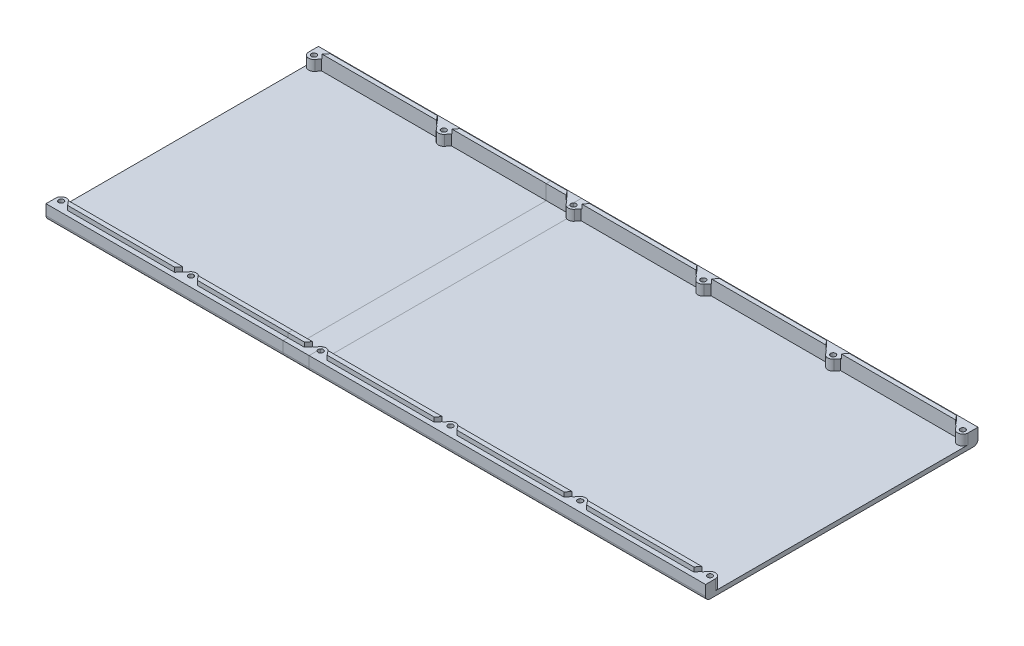
from build123d import *

# Parameters (mm, degrees)
BOSS_EXTRUDE1_DEPTH                     = 445
FILLET1_R                               = 3
BOSS_EXTRUDE2_START                     = -10
BOSS_EXTRUDE2_DEPTH                     = 7.000001
CUT_EXTRUDE2_DEPTH                      = 10
CBORE_FOR_M6_HEX_HEAD_BOLT1_D           = 3.5
CBORE_FOR_M6_HEX_HEAD_BOLT1_CBORE_D     = 6.5
CBORE_FOR_M6_HEX_HEAD_BOLT1_CBORE_DEPTH = 4
SPLIT1_START                            = -329.974562358
SPLIT1_DEPTH                            = 177.5
SPLIT1_START_2                          = -20.219509128
SPLIT1_2_OUTLINE_W                      = 160
SPLIT1_2_OUTLINE_H                      = 183.812885504
SPLIT1_2_OUTLINE_R                      = 3.25
SPLIT1_2_DEPTH                          = 3
SPLIT1_START_3                          = -17.219509128
SPLIT1_3_OUTLINE_R                      = 3.25
SPLIT1_3_DEPTH                          = 7
SPLIT1_START_4                          = -10.219509128
SPLIT1_4_DEPTH                          = 3
SPLIT1_START_5                          = -16.219509128
SPLIT1_5_OUTLINE_R                      = 3.25
SPLIT1_5_OUTLINE_R_2                    = 1.75
SPLIT1_5_DEPTH                          = 6
SPLIT1_START_6                          = -331
SPLIT1_6_DEPTH                          = 162
SPLIT1_7_DEPTH                          = 3
SPLIT1_8_DEPTH                          = 7
SPLIT1_9_DEPTH                          = 3
SPLIT1_10_DEPTH                         = 6
SPLIT1_START_7                          = -169.974562358
SPLIT1_11_DEPTH                         = 15.470068639
SPLIT1_START_8                          = -154.504562358
SPLIT1_12_DEPTH                         = 2.03
SPLIT1_13_DEPTH                         = 3


with BuildPart() as part:
    # Sketch1 → Boss-Extrude1 (new body)
    with BuildSketch(Plane.ZY.offset(329.974562358)):
        Polygon((-32.648970599, -10.219509128), (-32.648970599, -20.219509128), (151.163914905, -20.219509128), (151.163914905, -10.219509128), (148.163914905, -10.219509128), (147.863914905, -10.219509128), (147.863914905, -7.219509128), (144.863914905, -7.219509128), (144.863914905, -17.219509128), (-26.348970599, -17.219509128), (-26.348970599, -7.219509128), (-29.348970599, -7.219509128), (-29.348970599, -10.219509128), (-29.648970599, -10.219509128), align=None)
    extrude(amount=-BOSS_EXTRUDE1_DEPTH)

    # Fillet1
    fillet1_edges = [part.edges().sort_by_distance(p)[0] for p in [
        (-107.474562358, -20.219509128, 151.163914905),
        (-107.474562358, -20.219509128, -32.648970599),
    ]]
    fillet(fillet1_edges, radius=FILLET1_R)

    # Sketch2 → Boss-Extrude2 (add)
    with BuildSketch(Plane(origin=(0, -0.219509128, 0), x_dir=(1, 0, 0), z_dir=(0, 1, 0)).offset(BOSS_EXTRUDE2_START)):
        with BuildLine():
            Line((-329.974562358, 29.648970599), (-329.974562358, 26.048970599))
            ThreePointArc((-329.974562358, 26.048970599), (-327.567305693, 22.652301151), (-323.564916059, 23.798217909))
            Line((-323.564916059, 23.798217909), (-318.882172227, 29.648970599))
            Line((-318.882172227, 29.648970599), (-246.30695249, 29.648970599))
            Line((-246.30695249, 29.648970599), (-241.624208658, 23.798217909))
            ThreePointArc((-241.624208658, 23.798217909), (-238.814562358, 22.448970599), (-236.004916059, 23.798217909))
            Line((-236.004916059, 23.798217909), (-231.322172227, 29.648970599))
            Line((-231.322172227, 29.648970599), (-158.74695249, 29.648970599))
            Line((-158.74695249, 29.648970599), (-154.064208658, 23.798217909))
            ThreePointArc((-154.064208658, 23.798217909), (-151.254562358, 22.448970599), (-148.444916059, 23.798217909))
            Line((-148.444916059, 23.798217909), (-143.762172227, 29.648970599))
            Line((-143.762172227, 29.648970599), (-71.18695249, 29.648970599))
            Line((-71.18695249, 29.648970599), (-66.504208658, 23.798217909))
            ThreePointArc((-66.504208658, 23.798217909), (-63.694562358, 22.448970599), (-60.884916059, 23.798217909))
            Line((-60.884916059, 23.798217909), (-56.202172227, 29.648970599))
            Line((-56.202172227, 29.648970599), (16.37304751, 29.648970599))
            Line((16.37304751, 29.648970599), (21.055791342, 23.798217909))
            ThreePointArc((21.055791342, 23.798217909), (23.865437642, 22.448970599), (26.675083941, 23.798217909))
            Line((26.675083941, 23.798217909), (31.357827773, 29.648970599))
            Line((31.357827773, 29.648970599), (103.93304751, 29.648970599))
            Line((103.93304751, 29.648970599), (108.615791342, 23.798217909))
            ThreePointArc((108.615791342, 23.798217909), (112.618180976, 22.652301151), (115.025437642, 26.048970599))
            Line((115.025437642, 26.048970599), (115.025437642, 32.648970599))
            Line((115.025437642, 32.648970599), (-329.974562358, 32.648970599))
            Line((-329.974562358, 32.648970599), (-329.974562358, 29.648970599))
        make_face()
        with BuildLine():
            Line((115.025437642, -151.163914905), (115.025437642, -144.563914905))
            ThreePointArc((115.025437642, -144.563914905), (112.618180976, -141.167245457), (108.615791342, -142.313162215))
            Line((108.615791342, -142.313162215), (103.93304751, -148.163914905))
            Line((103.93304751, -148.163914905), (31.357827773, -148.163914905))
            Line((31.357827773, -148.163914905), (26.675083941, -142.313162215))
            ThreePointArc((26.675083941, -142.313162215), (23.865437642, -140.963914905), (21.055791342, -142.313162215))
            Line((21.055791342, -142.313162215), (16.37304751, -148.163914905))
            Line((16.37304751, -148.163914905), (-56.202172227, -148.163914905))
            Line((-56.202172227, -148.163914905), (-60.884916059, -142.313162215))
            ThreePointArc((-60.884916059, -142.313162215), (-63.694562358, -140.963914905), (-66.504208658, -142.313162215))
            Line((-66.504208658, -142.313162215), (-71.18695249, -148.163914905))
            Line((-71.18695249, -148.163914905), (-143.762172227, -148.163914905))
            Line((-143.762172227, -148.163914905), (-148.444916059, -142.313162215))
            ThreePointArc((-148.444916059, -142.313162215), (-151.254562358, -140.963914905), (-154.064208658, -142.313162215))
            Line((-154.064208658, -142.313162215), (-158.74695249, -148.163914905))
            Line((-158.74695249, -148.163914905), (-231.322172227, -148.163914905))
            Line((-231.322172227, -148.163914905), (-236.004916059, -142.313162215))
            ThreePointArc((-236.004916059, -142.313162215), (-238.814562358, -140.963914905), (-241.624208658, -142.313162215))
            Line((-241.624208658, -142.313162215), (-246.30695249, -148.163914905))
            Line((-246.30695249, -148.163914905), (-318.882172227, -148.163914905))
            Line((-318.882172227, -148.163914905), (-323.564916059, -142.313162215))
            ThreePointArc((-323.564916059, -142.313162215), (-327.567305693, -141.167245457), (-329.974562358, -144.563914905))
            Line((-329.974562358, -144.563914905), (-329.974562358, -151.163914905))
            Line((-329.974562358, -151.163914905), (115.025437642, -151.163914905))
        make_face()
    extrude(amount=-BOSS_EXTRUDE2_DEPTH)

    # Sketch2<3> → Cut-Extrude2 (cut)
    # profile 1 of 4: a face of its own
    with BuildSketch(Plane(origin=(0, -0.219509128, 0), x_dir=(1, 0, 0), z_dir=(0, 1, 0))):
        with BuildLine():
            Line((16.228901261, 29.348970599), (20.821613339, 23.610706153))
            ThreePointArc((20.821613339, 23.610706153), (23.865437642, 22.148970613), (26.909261944, 23.610706153))
            Line((26.909261944, 23.610706153), (31.501974023, 29.348970599))
            Line((31.501974023, 29.348970599), (103.788901261, 29.348970599))
            Line((103.788901261, 29.348970599), (108.381613339, 23.610706153))
            ThreePointArc((108.381613339, 23.610706153), (112.717545446, 22.36923456), (115.325437642, 26.048970599))
            Line((115.325437642, 26.048970599), (115.325437642, 32.948970599))
            Line((115.325437642, 32.948970599), (-330.274562358, 32.948970599))
            Line((-330.274562358, 32.948970599), (-330.274562358, 29.648970599))
            Line((-330.274562358, 29.648970599), (-330.274562358, 26.048970599))
            ThreePointArc((-330.274562358, 26.048970599), (-327.666670167, 22.369234548), (-323.330738056, 23.610706153))
            Line((-323.330738056, 23.610706153), (-318.738025977, 29.348970599))
            Line((-318.738025977, 29.348970599), (-246.451098739, 29.348970599))
            Line((-246.451098739, 29.348970599), (-241.858386661, 23.610706153))
            ThreePointArc((-241.858386661, 23.610706153), (-238.814562358, 22.148970613), (-235.770738056, 23.610706153))
            Line((-235.770738056, 23.610706153), (-231.178025977, 29.348970599))
            Line((-231.178025977, 29.348970599), (-158.891098739, 29.348970599))
            Line((-158.891098739, 29.348970599), (-154.298386661, 23.610706153))
            ThreePointArc((-154.298386661, 23.610706153), (-151.254562358, 22.148970613), (-148.210738056, 23.610706153))
            Line((-148.210738056, 23.610706153), (-143.618025977, 29.348970599))
            Line((-143.618025977, 29.348970599), (-71.331098739, 29.348970599))
            Line((-71.331098739, 29.348970599), (-66.738386661, 23.610706153))
            ThreePointArc((-66.738386661, 23.610706153), (-63.694562358, 22.148970613), (-60.650738056, 23.610706153))
            Line((-60.650738056, 23.610706153), (-56.058025977, 29.348970599))
            Line((-56.058025977, 29.348970599), (16.228901261, 29.348970599))
        make_face()
        with BuildLine():
            ThreePointArc((-329.974562358, 26.048970599), (-327.567305693, 22.652301151), (-323.564916059, 23.798217909))
            Line((-323.564916059, 23.798217909), (-318.882172227, 29.648970599))
            Line((-318.882172227, 29.648970599), (-246.30695249, 29.648970599))
            Line((-246.30695249, 29.648970599), (-241.624208658, 23.798217909))
            ThreePointArc((-241.624208658, 23.798217909), (-238.814562358, 22.448970599), (-236.004916059, 23.798217909))
            Line((-236.004916059, 23.798217909), (-231.322172227, 29.648970599))
            Line((-231.322172227, 29.648970599), (-158.74695249, 29.648970599))
            Line((-158.74695249, 29.648970599), (-154.064208658, 23.798217909))
            ThreePointArc((-154.064208658, 23.798217909), (-151.254562358, 22.448970599), (-148.444916059, 23.798217909))
            Line((-148.444916059, 23.798217909), (-143.762172227, 29.648970599))
            Line((-143.762172227, 29.648970599), (-71.18695249, 29.648970599))
            Line((-71.18695249, 29.648970599), (-66.504208658, 23.798217909))
            ThreePointArc((-66.504208658, 23.798217909), (-63.694562358, 22.448970599), (-60.884916059, 23.798217909))
            Line((-60.884916059, 23.798217909), (-56.202172227, 29.648970599))
            Line((-56.202172227, 29.648970599), (16.37304751, 29.648970599))
            Line((16.37304751, 29.648970599), (21.055791342, 23.798217909))
            ThreePointArc((21.055791342, 23.798217909), (23.865437642, 22.448970599), (26.675083941, 23.798217909))
            Line((26.675083941, 23.798217909), (31.357827773, 29.648970599))
            Line((31.357827773, 29.648970599), (103.93304751, 29.648970599))
            Line((103.93304751, 29.648970599), (108.615791342, 23.798217909))
            ThreePointArc((108.615791342, 23.798217909), (112.618180976, 22.652301151), (115.025437642, 26.048970599))
            Line((115.025437642, 26.048970599), (115.025437642, 32.648970599))
            Line((115.025437642, 32.648970599), (-329.974562358, 32.648970599))
            Line((-329.974562358, 32.648970599), (-329.974562358, 29.648970599))
            Line((-329.974562358, 29.648970599), (-329.974562358, 26.048970599))
        make_face(mode=Mode.SUBTRACT)
    # profile 2 of 4: a face of its own
    with BuildSketch(Plane(origin=(0, -0.219509128, 0), x_dir=(1, 0, 0), z_dir=(0, 1, 0))):
        with BuildLine():
            Line((-329.974562358, 29.648970599), (-329.974562358, 26.048970599))
            ThreePointArc((-329.974562358, 26.048970599), (-327.567305693, 22.652301151), (-323.564916059, 23.798217909))
            Line((-323.564916059, 23.798217909), (-318.882172227, 29.648970599))
            Line((-318.882172227, 29.648970599), (-246.30695249, 29.648970599))
            Line((-246.30695249, 29.648970599), (-241.624208658, 23.798217909))
            ThreePointArc((-241.624208658, 23.798217909), (-238.814562358, 22.448970599), (-236.004916059, 23.798217909))
            Line((-236.004916059, 23.798217909), (-231.322172227, 29.648970599))
            Line((-231.322172227, 29.648970599), (-158.74695249, 29.648970599))
            Line((-158.74695249, 29.648970599), (-154.064208658, 23.798217909))
            ThreePointArc((-154.064208658, 23.798217909), (-151.254562358, 22.448970599), (-148.444916059, 23.798217909))
            Line((-148.444916059, 23.798217909), (-143.762172227, 29.648970599))
            Line((-143.762172227, 29.648970599), (-71.18695249, 29.648970599))
            Line((-71.18695249, 29.648970599), (-66.504208658, 23.798217909))
            ThreePointArc((-66.504208658, 23.798217909), (-63.694562358, 22.448970599), (-60.884916059, 23.798217909))
            Line((-60.884916059, 23.798217909), (-56.202172227, 29.648970599))
            Line((-56.202172227, 29.648970599), (16.37304751, 29.648970599))
            Line((16.37304751, 29.648970599), (21.055791342, 23.798217909))
            ThreePointArc((21.055791342, 23.798217909), (23.865437642, 22.448970599), (26.675083941, 23.798217909))
            Line((26.675083941, 23.798217909), (31.357827773, 29.648970599))
            Line((31.357827773, 29.648970599), (103.93304751, 29.648970599))
            Line((103.93304751, 29.648970599), (108.615791342, 23.798217909))
            ThreePointArc((108.615791342, 23.798217909), (112.618180976, 22.652301151), (115.025437642, 26.048970599))
            Line((115.025437642, 26.048970599), (115.025437642, 32.648970599))
            Line((115.025437642, 32.648970599), (-329.974562358, 32.648970599))
            Line((-329.974562358, 32.648970599), (-329.974562358, 29.648970599))
        make_face()
    # profile 3 of 4: a face of its own
    with BuildSketch(Plane(origin=(0, -0.219509128, 0), x_dir=(1, 0, 0), z_dir=(0, 1, 0))):
        with BuildLine():
            Line((-318.738025977, -147.863914905), (-323.330738056, -142.125650459))
            ThreePointArc((-323.330738056, -142.125650459), (-327.666670163, -140.884178866), (-330.274562358, -144.563914905))
            Line((-330.274562358, -144.563914905), (-330.274562358, -151.463914905))
            Line((-330.274562358, -151.463914905), (115.325437642, -151.463914905))
            Line((115.325437642, -151.463914905), (115.325437642, -144.563914905))
            ThreePointArc((115.325437642, -144.563914905), (112.717545451, -140.884178853), (108.381613339, -142.125650459))
            Line((108.381613339, -142.125650459), (103.788901261, -147.863914905))
            Line((103.788901261, -147.863914905), (31.501974023, -147.863914905))
            Line((31.501974023, -147.863914905), (26.909261944, -142.125650459))
            ThreePointArc((26.909261944, -142.125650459), (23.865437642, -140.663914919), (20.821613339, -142.125650459))
            Line((20.821613339, -142.125650459), (16.228901261, -147.863914905))
            Line((16.228901261, -147.863914905), (-56.058025977, -147.863914905))
            Line((-56.058025977, -147.863914905), (-60.650738056, -142.125650459))
            ThreePointArc((-60.650738056, -142.125650459), (-63.694562358, -140.663914919), (-66.738386661, -142.125650459))
            Line((-66.738386661, -142.125650459), (-71.331098739, -147.863914905))
            Line((-71.331098739, -147.863914905), (-143.618025977, -147.863914905))
            Line((-143.618025977, -147.863914905), (-148.210738056, -142.125650459))
            ThreePointArc((-148.210738056, -142.125650459), (-151.254562358, -140.663914919), (-154.298386661, -142.125650459))
            Line((-154.298386661, -142.125650459), (-158.891098739, -147.863914905))
            Line((-158.891098739, -147.863914905), (-231.178025977, -147.863914905))
            Line((-231.178025977, -147.863914905), (-235.770738056, -142.125650459))
            ThreePointArc((-235.770738056, -142.125650459), (-238.814562358, -140.663914919), (-241.858386661, -142.125650459))
            Line((-241.858386661, -142.125650459), (-246.451098739, -147.863914905))
            Line((-246.451098739, -147.863914905), (-318.738025977, -147.863914905))
        make_face()
        with BuildLine():
            ThreePointArc((115.025437642, -144.563914905), (112.618180976, -141.167245457), (108.615791342, -142.313162215))
            Line((108.615791342, -142.313162215), (103.93304751, -148.163914905))
            Line((103.93304751, -148.163914905), (31.357827773, -148.163914905))
            Line((31.357827773, -148.163914905), (26.675083941, -142.313162215))
            ThreePointArc((26.675083941, -142.313162215), (23.865437642, -140.963914905), (21.055791342, -142.313162215))
            Line((21.055791342, -142.313162215), (16.37304751, -148.163914905))
            Line((16.37304751, -148.163914905), (-56.202172227, -148.163914905))
            Line((-56.202172227, -148.163914905), (-60.884916059, -142.313162215))
            ThreePointArc((-60.884916059, -142.313162215), (-63.694562358, -140.963914905), (-66.504208658, -142.313162215))
            Line((-66.504208658, -142.313162215), (-71.18695249, -148.163914905))
            Line((-71.18695249, -148.163914905), (-143.762172227, -148.163914905))
            Line((-143.762172227, -148.163914905), (-148.444916059, -142.313162215))
            ThreePointArc((-148.444916059, -142.313162215), (-151.254562358, -140.963914905), (-154.064208658, -142.313162215))
            Line((-154.064208658, -142.313162215), (-158.74695249, -148.163914905))
            Line((-158.74695249, -148.163914905), (-231.322172227, -148.163914905))
            Line((-231.322172227, -148.163914905), (-236.004916059, -142.313162215))
            ThreePointArc((-236.004916059, -142.313162215), (-238.814562358, -140.963914905), (-241.624208658, -142.313162215))
            Line((-241.624208658, -142.313162215), (-246.30695249, -148.163914905))
            Line((-246.30695249, -148.163914905), (-318.882172227, -148.163914905))
            Line((-318.882172227, -148.163914905), (-323.564916059, -142.313162215))
            ThreePointArc((-323.564916059, -142.313162215), (-327.567305693, -141.167245457), (-329.974562358, -144.563914905))
            Line((-329.974562358, -144.563914905), (-329.974562358, -151.163914905))
            Line((-329.974562358, -151.163914905), (115.025437642, -151.163914905))
            Line((115.025437642, -151.163914905), (115.025437642, -144.563914905))
        make_face(mode=Mode.SUBTRACT)
    # profile 4 of 4: a face of its own
    with BuildSketch(Plane(origin=(0, -0.219509128, 0), x_dir=(1, 0, 0), z_dir=(0, 1, 0))):
        with BuildLine():
            Line((115.025437642, -151.163914905), (115.025437642, -144.563914905))
            ThreePointArc((115.025437642, -144.563914905), (112.618180976, -141.167245457), (108.615791342, -142.313162215))
            Line((108.615791342, -142.313162215), (103.93304751, -148.163914905))
            Line((103.93304751, -148.163914905), (31.357827773, -148.163914905))
            Line((31.357827773, -148.163914905), (26.675083941, -142.313162215))
            ThreePointArc((26.675083941, -142.313162215), (23.865437642, -140.963914905), (21.055791342, -142.313162215))
            Line((21.055791342, -142.313162215), (16.37304751, -148.163914905))
            Line((16.37304751, -148.163914905), (-56.202172227, -148.163914905))
            Line((-56.202172227, -148.163914905), (-60.884916059, -142.313162215))
            ThreePointArc((-60.884916059, -142.313162215), (-63.694562358, -140.963914905), (-66.504208658, -142.313162215))
            Line((-66.504208658, -142.313162215), (-71.18695249, -148.163914905))
            Line((-71.18695249, -148.163914905), (-143.762172227, -148.163914905))
            Line((-143.762172227, -148.163914905), (-148.444916059, -142.313162215))
            ThreePointArc((-148.444916059, -142.313162215), (-151.254562358, -140.963914905), (-154.064208658, -142.313162215))
            Line((-154.064208658, -142.313162215), (-158.74695249, -148.163914905))
            Line((-158.74695249, -148.163914905), (-231.322172227, -148.163914905))
            Line((-231.322172227, -148.163914905), (-236.004916059, -142.313162215))
            ThreePointArc((-236.004916059, -142.313162215), (-238.814562358, -140.963914905), (-241.624208658, -142.313162215))
            Line((-241.624208658, -142.313162215), (-246.30695249, -148.163914905))
            Line((-246.30695249, -148.163914905), (-318.882172227, -148.163914905))
            Line((-318.882172227, -148.163914905), (-323.564916059, -142.313162215))
            ThreePointArc((-323.564916059, -142.313162215), (-327.567305693, -141.167245457), (-329.974562358, -144.563914905))
            Line((-329.974562358, -144.563914905), (-329.974562358, -151.163914905))
            Line((-329.974562358, -151.163914905), (115.025437642, -151.163914905))
        make_face()
    extrude(amount=-CUT_EXTRUDE2_DEPTH, mode=Mode.SUBTRACT)

    # CBORE for M6 Hex Head Bolt1 (through all)
    with Locations(Plane(origin=(0, -20.219509128, 0), x_dir=(-1, 0, 0), z_dir=(0, -1, 0))):
        with Locations((326.374562358, -144.563914905), (238.814562358, -144.563914905), (151.254562358, -144.563914905), (63.694562358, -144.563914905), (-23.865437642, -144.563914905), (-111.425437642, -144.563914905), (-111.425437642, 26.048970599), (-23.865437642, 26.048970599), (63.694562358, 26.048970599), (151.254562358, 26.048970599), (238.814562358, 26.048970599), (326.374562358, 26.048970599)):
            CounterBoreHole(CBORE_FOR_M6_HEX_HEAD_BOLT1_D / 2, CBORE_FOR_M6_HEX_HEAD_BOLT1_CBORE_D / 2, CBORE_FOR_M6_HEX_HEAD_BOLT1_CBORE_DEPTH)

    # Split1: read off the stored shape, not the designer's step
    # Split1 outline → Split1 (cut)
    with BuildSketch(Plane.YZ.offset(SPLIT1_START)):
        with BuildLine():
            Line((-7.219509128, -26.348970599), (-10.219509128, -26.348970599))
            Line((-10.219509128, -26.348970599), (-10.219509128, 144.863914905))
            Line((-10.219509128, 144.863914905), (-7.219509128, 144.863914905))
            Line((-7.219509128, 144.863914905), (-7.219509128, 147.863914905))
            Line((-7.219509128, 147.863914905), (-10.219509128, 147.863914905))
            Line((-10.219509128, 147.863914905), (-10.219509128, 151.163914905))
            Line((-10.219509128, 151.163914905), (-17.219509128, 151.163914905))
            ThreePointArc((-17.219509128, 151.163914905), (-19.340829471, 150.285235248), (-20.219509128, 148.163914905))
            Line((-20.219509128, 148.163914905), (-20.219509128, -29.648970599))
            ThreePointArc((-20.219509128, -29.648970599), (-19.340829472, -31.770290943), (-17.219509128, -32.648970599))
            Line((-17.219509128, -32.648970599), (-10.219509128, -32.648970599))
            Line((-10.219509128, -32.648970599), (-10.219509128, -29.348970599))
            Line((-10.219509128, -29.348970599), (-7.219509128, -29.348970599))
            Line((-7.219509128, -29.348970599), (-7.219509128, -26.348970599))
        make_face()
    extrude(amount=SPLIT1_DEPTH, mode=Mode.SUBTRACT)


with BuildPart() as body_2:
    # Split1 2 outline → Split1 2 (new body)
    with BuildSketch(Plane(origin=(0, 0, 0), x_dir=(1, 0, 0), z_dir=(0, 1, 0)).offset(SPLIT1_START_2)):
        with Locations((-249.974562358, -59.257472153)):
            Rectangle(SPLIT1_2_OUTLINE_W, SPLIT1_2_OUTLINE_H)
        with Locations((-326.374562358, 26.048970599)):
            Circle(SPLIT1_2_OUTLINE_R, mode=Mode.SUBTRACT)
        with Locations((-238.814562358, 26.048970599)):
            Circle(SPLIT1_2_OUTLINE_R, mode=Mode.SUBTRACT)
        with Locations((-238.814562358, -144.563914905)):
            Circle(SPLIT1_2_OUTLINE_R, mode=Mode.SUBTRACT)
        with Locations((-326.374562358, -144.563914905)):
            Circle(SPLIT1_2_OUTLINE_R, mode=Mode.SUBTRACT)
    extrude(amount=SPLIT1_2_DEPTH)

    # Split1 3 outline → Split1 3 (add)
    # profile 1 of 2: a face of its own
    with BuildSketch(Plane(origin=(0, 0, 0), x_dir=(1, 0, 0), z_dir=(0, 1, 0)).offset(SPLIT1_START_3)):
        with BuildLine():
            Line((-169.974562358, 32.648970599), (-329.974562358, 32.648970599))
            Line((-329.974562358, 32.648970599), (-329.974562358, 26.048970599))
            ThreePointArc((-329.974562358, 26.048970599), (-327.567305692, 22.652301151), (-323.564916059, 23.798217909))
            Line((-323.564916059, 23.798217909), (-321.523380199, 26.348970599))
            Line((-321.523380199, 26.348970599), (-243.665744518, 26.348970599))
            Line((-243.665744518, 26.348970599), (-241.624208658, 23.798217909))
            ThreePointArc((-241.624208658, 23.798217909), (-238.814562359, 22.448970599), (-236.004916059, 23.798217909))
            Line((-236.004916059, 23.798217909), (-233.963380199, 26.348970599))
            Line((-233.963380199, 26.348970599), (-169.974562358, 26.348970599))
            Line((-169.974562358, 26.348970599), (-169.974562358, 32.648970599))
        make_face()
        with Locations((-326.374562358, 26.048970599)):
            Circle(SPLIT1_3_OUTLINE_R, mode=Mode.SUBTRACT)
        with Locations((-238.814562358, 26.048970599)):
            Circle(SPLIT1_3_OUTLINE_R, mode=Mode.SUBTRACT)
    # profile 2 of 2: a face of its own
    with BuildSketch(Plane(origin=(0, 0, 0), x_dir=(1, 0, 0), z_dir=(0, 1, 0)).offset(SPLIT1_START_3)):
        with BuildLine():
            Line((-169.974562358, -144.863914905), (-233.963380199, -144.863914905))
            Line((-233.963380199, -144.863914905), (-236.004916059, -142.313162215))
            ThreePointArc((-236.004916059, -142.313162215), (-238.814562359, -140.963914905), (-241.624208658, -142.313162215))
            Line((-241.624208658, -142.313162215), (-243.665744518, -144.863914905))
            Line((-243.665744518, -144.863914905), (-321.523380199, -144.863914905))
            Line((-321.523380199, -144.863914905), (-323.564916059, -142.313162215))
            ThreePointArc((-323.564916059, -142.313162215), (-327.567305692, -141.167245457), (-329.974562358, -144.563914905))
            Line((-329.974562358, -144.563914905), (-329.974562358, -151.163914905))
            Line((-329.974562358, -151.163914905), (-169.974562358, -151.163914905))
            Line((-169.974562358, -151.163914905), (-169.974562358, -144.863914905))
        make_face()
        with Locations((-326.374562358, -144.563914905)):
            Circle(SPLIT1_3_OUTLINE_R, mode=Mode.SUBTRACT)
        with Locations((-238.814562358, -144.563914905)):
            Circle(SPLIT1_3_OUTLINE_R, mode=Mode.SUBTRACT)
    extrude(amount=SPLIT1_3_DEPTH)

    # Split1 4 outline → Split1 4 (add)
    with BuildSketch(Plane(origin=(0, 0, 0), x_dir=(1, 0, 0), z_dir=(0, 1, 0)).offset(SPLIT1_START_4)):
        Polygon((-169.974562358, 26.348970599), (-169.974562358, 29.348970599), (-231.178025977, 29.348970599), (-233.579124143, 26.348970599), align=None)
        Polygon((-169.974562358, -147.863914905), (-169.974562358, -144.863914905), (-233.579124143, -144.863914905), (-231.178025977, -147.863914905), align=None)
        Polygon((-318.738025977, 29.348970599), (-321.139124143, 26.348970599), (-244.050000574, 26.348970599), (-246.451098739, 29.348970599), align=None)
        Polygon((-244.050000574, -144.863914905), (-321.139124143, -144.863914905), (-318.738025977, -147.863914905), (-246.451098739, -147.863914905), align=None)
    extrude(amount=SPLIT1_4_DEPTH)

    # Split1 5 outline → Split1 5 (add)
    # profile 1 of 4: a face of its own
    with BuildSketch(Plane(origin=(0, 0, 0), x_dir=(1, 0, 0), z_dir=(0, 1, 0)).offset(SPLIT1_START_5)):
        with Locations((-326.374562358, 26.048970599)):
            Circle(SPLIT1_5_OUTLINE_R)
        with Locations((-326.374562358, 26.048970599)):
            Circle(SPLIT1_5_OUTLINE_R_2, mode=Mode.SUBTRACT)
    # profile 2 of 4: a face of its own
    with BuildSketch(Plane(origin=(0, 0, 0), x_dir=(1, 0, 0), z_dir=(0, 1, 0)).offset(SPLIT1_START_5)):
        with Locations((-238.814562358, 26.048970599)):
            Circle(SPLIT1_5_OUTLINE_R)
        with Locations((-238.814562358, 26.048970599)):
            Circle(SPLIT1_5_OUTLINE_R_2, mode=Mode.SUBTRACT)
    # profile 3 of 4: a face of its own
    with BuildSketch(Plane(origin=(0, 0, 0), x_dir=(1, 0, 0), z_dir=(0, 1, 0)).offset(SPLIT1_START_5)):
        with Locations((-238.814562358, -144.563914905)):
            Circle(SPLIT1_5_OUTLINE_R)
        with Locations((-238.814562358, -144.563914905)):
            Circle(SPLIT1_5_OUTLINE_R_2, mode=Mode.SUBTRACT)
    # profile 4 of 4: a face of its own
    with BuildSketch(Plane(origin=(0, 0, 0), x_dir=(1, 0, 0), z_dir=(0, 1, 0)).offset(SPLIT1_START_5)):
        with Locations((-326.374562358, -144.563914905)):
            Circle(SPLIT1_5_OUTLINE_R)
        with Locations((-326.374562358, -144.563914905)):
            Circle(SPLIT1_5_OUTLINE_R_2, mode=Mode.SUBTRACT)
    extrude(amount=SPLIT1_5_DEPTH)

    # Split1 6 outline → Split1 6 (cut)
    with BuildSketch(Plane.YZ.offset(SPLIT1_START_6)):
        with BuildLine():
            Line((-20.219509128, -32.648970599), (-17.219509128, -32.648970599))
            ThreePointArc((-17.219509128, -32.648970599), (-19.340829472, -31.770290943), (-20.219509128, -29.648970599))
            Line((-20.219509128, -29.648970599), (-20.219509128, -32.648970599))
        make_face()
        with BuildLine():
            Line((-20.219509128, 151.163914905), (-20.219509128, 148.163914905))
            ThreePointArc((-20.219509128, 148.163914905), (-19.340829471, 150.285235248), (-17.219509128, 151.163914905))
            Line((-17.219509128, 151.163914905), (-20.219509128, 151.163914905))
        make_face()
    extrude(amount=SPLIT1_6_DEPTH, mode=Mode.SUBTRACT)


with BuildPart() as body_3:
    # Split1 7 outline → Split1 7 (new body)
    with BuildSketch(Plane(origin=(0, 0, 0), x_dir=(1, 0, 0), z_dir=(0, 1, 0)).offset(SPLIT1_START_2)):
        with BuildLine():
            Line((-158.891098739, 29.348970599), (-169.974562358, 29.348970599))
            Line((-169.974562358, 29.348970599), (-169.974562358, -147.863914905))
            Line((-169.974562358, -147.863914905), (-158.891098739, -147.863914905))
            Line((-158.891098739, -147.863914905), (-156.490000574, -144.863914905))
            Line((-156.490000574, -144.863914905), (-156.105744518, -144.863914905))
            Line((-156.105744518, -144.863914905), (-154.064208658, -142.313162215))
            ThreePointArc((-154.064208658, -142.313162215), (-153.347947807, -141.635137453), (-152.474562358, -141.176939853))
            Line((-152.474562358, -141.176939853), (-152.474562358, 22.661995548))
            ThreePointArc((-152.474562358, 22.661995548), (-153.347947807, 23.120193147), (-154.064208658, 23.798217909))
            Line((-154.064208658, 23.798217909), (-156.105744518, 26.348970599))
            Line((-156.105744518, 26.348970599), (-156.490000574, 26.348970599))
            Line((-156.490000574, 26.348970599), (-158.891098739, 29.348970599))
        make_face()
    extrude(amount=SPLIT1_7_DEPTH)

    # Split1 8 outline → Split1 8 (add)
    with BuildSketch(Plane(origin=(0, 0, 0), x_dir=(1, 0, 0), z_dir=(0, 1, 0)).offset(SPLIT1_START_3)):
        with BuildLine():
            Line((-152.474562358, 29.061295283), (-152.474562358, 32.648970599))
            Line((-152.474562358, 32.648970599), (-169.974562358, 32.648970599))
            Line((-169.974562358, 32.648970599), (-169.974562358, 26.348970599))
            Line((-169.974562358, 26.348970599), (-156.105744518, 26.348970599))
            Line((-156.105744518, 26.348970599), (-154.064208658, 23.798217909))
            ThreePointArc((-154.064208658, 23.798217909), (-153.347947807, 23.120193147), (-152.474562358, 22.661995548))
            Line((-152.474562358, 22.661995548), (-152.474562358, 23.036645916))
            ThreePointArc((-152.474562358, 23.036645916), (-154.504562358, 26.048970599), (-152.474562358, 29.061295283))
        make_face()
        with BuildLine():
            Line((-152.474562358, -141.551590221), (-152.474562358, -141.176939853))
            ThreePointArc((-152.474562358, -141.176939853), (-153.347947807, -141.635137453), (-154.064208658, -142.313162215))
            Line((-154.064208658, -142.313162215), (-156.105744518, -144.863914905))
            Line((-156.105744518, -144.863914905), (-169.974562358, -144.863914905))
            Line((-169.974562358, -144.863914905), (-169.974562358, -151.163914905))
            Line((-169.974562358, -151.163914905), (-152.474562358, -151.163914905))
            Line((-152.474562358, -151.163914905), (-152.474562358, -147.576239589))
            ThreePointArc((-152.474562358, -147.576239589), (-154.504562358, -144.563914905), (-152.474562358, -141.551590221))
        make_face()
    extrude(amount=SPLIT1_8_DEPTH)

    # Split1 9 outline → Split1 9 (add)
    with BuildSketch(Plane(origin=(0, 0, 0), x_dir=(1, 0, 0), z_dir=(0, 1, 0)).offset(SPLIT1_START_4)):
        Polygon((-158.891098739, 29.348970599), (-169.974562358, 29.348970599), (-169.974562358, 26.348970599), (-156.490000574, 26.348970599), align=None)
        Polygon((-156.490000574, -144.863914905), (-169.974562358, -144.863914905), (-169.974562358, -147.863914905), (-158.891098739, -147.863914905), align=None)
    extrude(amount=SPLIT1_9_DEPTH)

    # Split1 10 outline → Split1 10 (add)
    with BuildSketch(Plane(origin=(0, 0, 0), x_dir=(1, 0, 0), z_dir=(0, 1, 0)).offset(SPLIT1_START_5)):
        with BuildLine():
            Line((-152.474562358, 27.303602019), (-152.474562358, 29.061295283))
            ThreePointArc((-152.474562358, 29.061295283), (-154.504562358, 26.048970599), (-152.474562358, 23.036645916))
            Line((-152.474562358, 23.036645916), (-152.474562358, 24.794339179))
            ThreePointArc((-152.474562358, 24.794339179), (-153.004562358, 26.048970599), (-152.474562358, 27.303602019))
        make_face()
        with BuildLine():
            Line((-152.474562358, -143.309283485), (-152.474562358, -141.551590221))
            ThreePointArc((-152.474562358, -141.551590221), (-154.504562358, -144.563914905), (-152.474562358, -147.576239589))
            Line((-152.474562358, -147.576239589), (-152.474562358, -145.818546325))
            ThreePointArc((-152.474562358, -145.818546325), (-153.004562358, -144.563914905), (-152.474562358, -143.309283485))
        make_face()
    extrude(amount=SPLIT1_10_DEPTH)

    # Split1 11 outline → Split1 11 (add)
    with BuildSketch(Plane.YZ.offset(SPLIT1_START_7)):
        with BuildLine():
            Line((-17.219509128, -26.348970599), (-20.219509128, -26.348970599))
            Line((-20.219509128, -26.348970599), (-20.219509128, -29.648970599))
            ThreePointArc((-20.219509128, -29.648970599), (-19.340829472, -31.770290943), (-17.219509128, -32.648970599))
            Line((-17.219509128, -32.648970599), (-17.219509128, -26.348970599))
        make_face()
        with BuildLine():
            ThreePointArc((-17.219509128, 151.163914905), (-19.340829471, 150.285235248), (-20.219509128, 148.163914905))
            Line((-20.219509128, 148.163914905), (-20.219509128, 144.863914905))
            Line((-20.219509128, 144.863914905), (-17.219509128, 144.863914905))
            Line((-17.219509128, 144.863914905), (-17.219509128, 151.163914905))
        make_face()
    extrude(amount=SPLIT1_11_DEPTH)

    # Split1 12 outline → Split1 12 (add)
    with BuildSketch(Plane.YZ.offset(SPLIT1_START_8)):
        with BuildLine():
            ThreePointArc((-17.219509128, 151.163914905), (-19.340829471, 150.285235248), (-20.219509128, 148.163914905))
            Line((-20.219509128, 148.163914905), (-20.219509128, 147.863914905))
            Line((-20.219509128, 147.863914905), (-17.219509128, 147.863914905))
            Line((-17.219509128, 147.863914905), (-17.219509128, 151.163914905))
        make_face()
        with BuildLine():
            Line((-17.219509128, -29.348970599), (-20.219509128, -29.348970599))
            Line((-20.219509128, -29.348970599), (-20.219509128, -29.648970599))
            ThreePointArc((-20.219509128, -29.648970599), (-19.340829472, -31.770290943), (-17.219509128, -32.648970599))
            Line((-17.219509128, -32.648970599), (-17.219509128, -29.348970599))
        make_face()
    extrude(amount=SPLIT1_12_DEPTH)

    # Split1 13 outline → Split1 13 (add)
    with BuildSketch(Plane(origin=(0, 0, 0), x_dir=(1, 0, 0), z_dir=(0, 1, 0)).offset(SPLIT1_START_2)):
        with BuildLine():
            Line((-152.474562358, -147.863914905), (-152.474562358, -147.576239589))
            ThreePointArc((-152.474562358, -147.576239589), (-154.504562358, -144.563914905), (-152.474562358, -141.551590221))
            Line((-152.474562358, -141.551590221), (-152.474562358, -141.176939853))
            ThreePointArc((-152.474562358, -141.176939853), (-153.347947807, -141.635137453), (-154.064208658, -142.313162215))
            Line((-154.064208658, -142.313162215), (-156.105744518, -144.863914905))
            Line((-156.105744518, -144.863914905), (-154.504493719, -144.863914905))
            Line((-154.504493719, -144.863914905), (-154.504493719, -147.863914905))
            Line((-154.504493719, -147.863914905), (-152.474562358, -147.863914905))
        make_face()
        with BuildLine():
            ThreePointArc((-154.064208658, 23.798217909), (-153.347947807, 23.120193147), (-152.474562358, 22.661995548))
            Line((-152.474562358, 22.661995548), (-152.474562358, 23.036645916))
            ThreePointArc((-152.474562358, 23.036645916), (-154.504562358, 26.048970599), (-152.474562358, 29.061295283))
            Line((-152.474562358, 29.061295283), (-152.474562358, 29.348970599))
            Line((-152.474562358, 29.348970599), (-154.504493719, 29.348970599))
            Line((-154.504493719, 29.348970599), (-154.504493719, 26.348970599))
            Line((-154.504493719, 26.348970599), (-156.105744518, 26.348970599))
            Line((-156.105744518, 26.348970599), (-154.064208658, 23.798217909))
        make_face()
    extrude(amount=SPLIT1_13_DEPTH)


solid = Compound([part.part, body_2.part, body_3.part])
